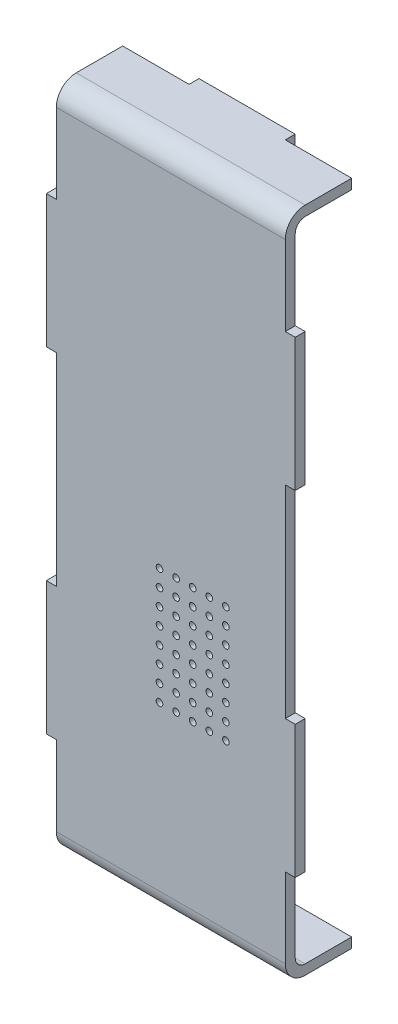
from build123d import *

# Parameters (mm, degrees)
SKETCH_1_W                       = 75
SKETCH_1_H                       = 192
SM_BASE_FLANGE_2_DEPTH           = 3
SM_EDGE_FLANGE_1_STRIP_W         = 18
SM_EDGE_FLANGE_1_STRIP_H         = 3
SM_EDGE_FLANGE_1_STRIP_CUT_DEPTH = 75
SM_EDGE_FLANGE_1_DEPTH           = 75
SM_EDGE_FLANGE_2_DEPTH           = 75
SKETCH_18_W                      = 3
SKETCH_18_H                      = 30
SKETCH_18_H_2                    = 61
CUT_EXTRUDE_1_DEPTH              = 30
SKETCH_19_W                      = 20
SKETCH_19_H                      = 3
CUT_EXTRUDE_2_DEPTH              = 203
SKETCH_20_R                      = 1
CUT_EXTRUDE_3_DEPTH              = 3


# Sheet-metal steps are written as plain solids
with BuildPart() as part:
    # 草图1 → 基体-法兰2 (new body)
    with BuildSketch(Plane.XY):
        with Locations((27.011429417, -3.544407938)):
            Rectangle(SKETCH_1_W, SKETCH_1_H)
    extrude(amount=-SM_BASE_FLANGE_2_DEPTH)

    # 边线-法兰1 strip (across the edge) → 边线-法兰1 strip cut (cut)
    with BuildSketch(Plane(origin=(64.511429417, -99.544407938, -3), x_dir=(0, 1, 0), z_dir=(-1, 0, 0))):
        with Locations((-6, -1.5)):
            Rectangle(SM_EDGE_FLANGE_1_STRIP_W, SM_EDGE_FLANGE_1_STRIP_H)
    extrude(amount=SM_EDGE_FLANGE_1_STRIP_CUT_DEPTH, mode=Mode.SUBTRACT)

    # 边线-法兰1 section (across the edge) → 边线-法兰1 (add)
    with BuildSketch(Plane(origin=(64.511429417, -99.544407938, -3), x_dir=(0, 1, 0), z_dir=(-1, 0, 0))):
        with BuildLine():
            Line((-3, 3), (-3, 20))
            Line((-3, 20), (0, 20))
            Line((0, 20), (0, 3))
            ThreePointArc((0, 3), (0.878679656, 0.878679656), (3, 0))
            Line((3, 0), (3, -3))
            ThreePointArc((3, -3), (-1.242640687, -1.242640687), (-3, 3))
        make_face()
    extrude(amount=SM_EDGE_FLANGE_1_DEPTH)

    # 边线-法兰2 section (across the edge) → 边线-法兰2 (add)
    with BuildSketch(Plane(origin=(-10.488570583, 95.455592062, -3), x_dir=(0, -1, 0), z_dir=(1, 0, 0))):
        with BuildLine():
            Line((-3, 3), (-3, 20))
            Line((-3, 20), (0, 20))
            Line((0, 20), (0, 3))
            ThreePointArc((0, 3), (0.878679656, 0.878679656), (3, 0))
            Line((3, 0), (3, -3))
            ThreePointArc((3, -3), (-1.242640687, -1.242640687), (-3, 3))
        make_face()
    extrude(amount=SM_EDGE_FLANGE_2_DEPTH)

    # 草图18 → 切除-拉伸1 (cut)
    with BuildSketch(Plane.XY):
        with Locations((63.011429417, -87.544407938)):
            Rectangle(SKETCH_18_W, SKETCH_18_H)
        with Locations((63.011429417, 83.455592062)):
            Rectangle(SKETCH_18_W, SKETCH_18_H)
        with Locations((63.011429417, -2.044407938)):
            Rectangle(SKETCH_18_W, SKETCH_18_H_2)
        with Locations((-8.988570583, -2.044407938)):
            Rectangle(SKETCH_18_W, SKETCH_18_H_2)
        with Locations((-8.988570583, -87.544407938)):
            Rectangle(SKETCH_18_W, SKETCH_18_H)
        with Locations((-8.988570583, 83.455592062)):
            Rectangle(SKETCH_18_W, SKETCH_18_H)
    extrude(amount=-CUT_EXTRUDE_1_DEPTH, mode=Mode.SUBTRACT)

    # 草图19 → 切除-拉伸2 (cut)
    with BuildSketch(Plane.XZ.offset(102.544407938)):
        with Locations((2.511429417, -21.5)):
            Rectangle(SKETCH_19_W, SKETCH_19_H)
        with Locations((51.511429417, -21.5)):
            Rectangle(SKETCH_19_W, SKETCH_19_H)
    extrude(amount=-CUT_EXTRUDE_2_DEPTH, mode=Mode.SUBTRACT)

    # 草图20 → 切除-拉伸3 (cut)
    with BuildSketch(Plane.XY):
        with Locations((23.610533211, -47.310308186)):
            Circle(SKETCH_20_R)
        with Locations((28.610533211, -47.310308186)):
            Circle(SKETCH_20_R)
        with Locations((33.610533211, -47.310308186)):
            Circle(SKETCH_20_R)
        with Locations((38.610533211, -47.310308186)):
            Circle(SKETCH_20_R)
        with Locations((43.610533211, -47.310308186)):
            Circle(SKETCH_20_R)
        with Locations((28.610533211, -42.310308186)):
            Circle(SKETCH_20_R)
        with Locations((33.610533211, -42.310308186)):
            Circle(SKETCH_20_R)
        with Locations((38.610533211, -42.310308186)):
            Circle(SKETCH_20_R)
        with Locations((43.610533211, -42.310308186)):
            Circle(SKETCH_20_R)
        with Locations((28.610533211, -37.310308186)):
            Circle(SKETCH_20_R)
        with Locations((33.610533211, -37.310308186)):
            Circle(SKETCH_20_R)
        with Locations((38.610533211, -37.310308186)):
            Circle(SKETCH_20_R)
        with Locations((43.610533211, -37.310308186)):
            Circle(SKETCH_20_R)
        with Locations((28.610533211, -32.310308186)):
            Circle(SKETCH_20_R)
        with Locations((33.610533211, -32.310308186)):
            Circle(SKETCH_20_R)
        with Locations((38.610533211, -32.310308186)):
            Circle(SKETCH_20_R)
        with Locations((43.610533211, -32.310308186)):
            Circle(SKETCH_20_R)
        with Locations((28.610533211, -27.310308186)):
            Circle(SKETCH_20_R)
        with Locations((33.610533211, -27.310308186)):
            Circle(SKETCH_20_R)
        with Locations((38.610533211, -27.310308186)):
            Circle(SKETCH_20_R)
        with Locations((43.610533211, -27.310308186)):
            Circle(SKETCH_20_R)
        with Locations((28.610533211, -22.310308186)):
            Circle(SKETCH_20_R)
        with Locations((33.610533211, -22.310308186)):
            Circle(SKETCH_20_R)
        with Locations((38.610533211, -22.310308186)):
            Circle(SKETCH_20_R)
        with Locations((43.610533211, -22.310308186)):
            Circle(SKETCH_20_R)
        with Locations((28.610533211, -17.310308186)):
            Circle(SKETCH_20_R)
        with Locations((33.610533211, -17.310308186)):
            Circle(SKETCH_20_R)
        with Locations((38.610533211, -17.310308186)):
            Circle(SKETCH_20_R)
        with Locations((43.610533211, -17.310308186)):
            Circle(SKETCH_20_R)
        with Locations((28.610533211, -12.310308186)):
            Circle(SKETCH_20_R)
        with Locations((33.610533211, -12.310308186)):
            Circle(SKETCH_20_R)
        with Locations((38.610533211, -12.310308186)):
            Circle(SKETCH_20_R)
        with Locations((43.610533211, -12.310308186)):
            Circle(SKETCH_20_R)
        with Locations((23.610533211, -42.310308186)):
            Circle(SKETCH_20_R)
        with Locations((23.610533211, -37.310308186)):
            Circle(SKETCH_20_R)
        with Locations((23.610533211, -32.310308186)):
            Circle(SKETCH_20_R)
        with Locations((23.610533211, -27.310308186)):
            Circle(SKETCH_20_R)
        with Locations((23.610533211, -22.310308186)):
            Circle(SKETCH_20_R)
        with Locations((23.610533211, -17.310308186)):
            Circle(SKETCH_20_R)
        with Locations((23.610533211, -12.310308186)):
            Circle(SKETCH_20_R)
    extrude(amount=-CUT_EXTRUDE_3_DEPTH, mode=Mode.SUBTRACT)


solid = part.part
